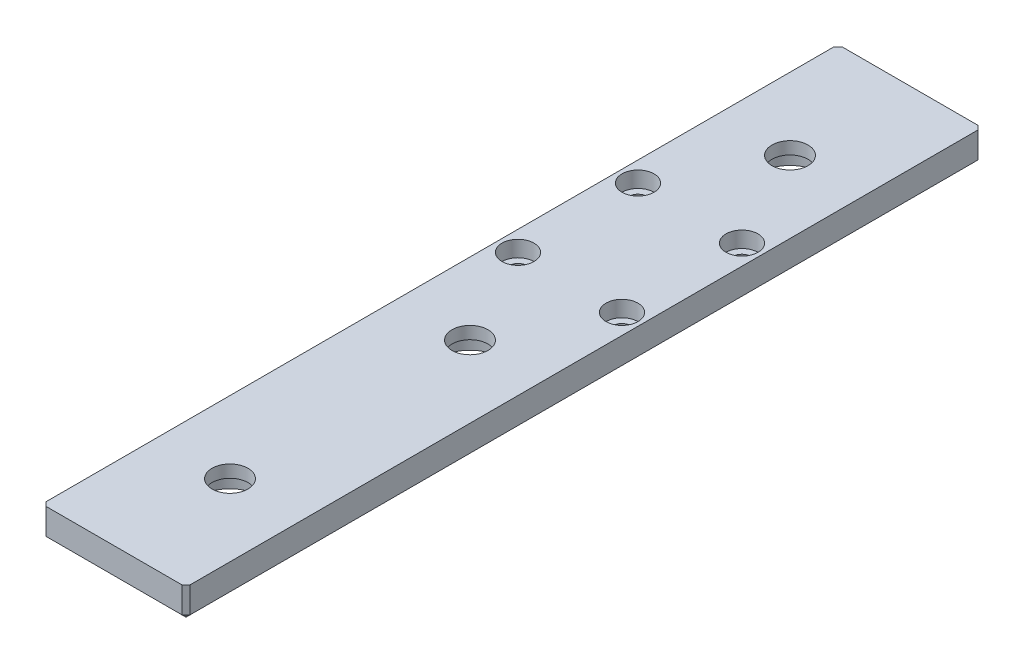
from build123d import *

# Parameters (mm, degrees)
SKETCH1_W                       = 36
SKETCH1_H                       = 199
BOSS_EXTRUDE1_DEPTH             = 7.5
CBORE_FOR_M4_SHCS1_D            = 4.5
CBORE_FOR_M4_SHCS1_CBORE_D      = 8
CBORE_FOR_M4_SHCS1_CBORE_DEPTH  = 4
CHAMFER1_SIZE                   = 1
CBORE_FOR_M8_SBHCS1_D           = 9
CBORE_FOR_M8_SBHCS1_CBORE_D     = 15
CBORE_FOR_M8_SBHCS1_CBORE_DEPTH = 4.4


with BuildPart() as part:
    # Sketch1 → Boss-Extrude1 (new body)
    with BuildSketch(Plane(origin=(0, 0, 0), x_dir=(1, 0, 0), z_dir=(0, 1, 0))):
        Rectangle(SKETCH1_W, SKETCH1_H)
    extrude(amount=BOSS_EXTRUDE1_DEPTH)

    # CBORE for M4 SHCS1 (through all)
    with Locations(Plane(origin=(0, 7.5, 0), x_dir=(1, 0, 0), z_dir=(0, 1, 0))):
        with Locations((-13, 44.5), (13, 44.5), (13, 14.5), (-13, 14.5)):
            CounterBoreHole(CBORE_FOR_M4_SHCS1_D / 2, CBORE_FOR_M4_SHCS1_CBORE_D / 2, CBORE_FOR_M4_SHCS1_CBORE_DEPTH)

    # Chamfer1
    chamfer1_edges = [part.edges().sort_by_distance(p)[0] for p in [
        (-18, 3.75, -99.5),
        (18, 3.75, -99.5),
        (-18, 3.75, 99.5),
        (18, 3.75, 99.5),
        (0, 0, -99.5),
        (-18, 0, 0),
        (0, 0, 99.5),
        (18, 0, 0),
    ]]
    chamfer(chamfer1_edges, length=CHAMFER1_SIZE)

    # CBORE for M8 SBHCS1 (through all)
    with Locations(Plane(origin=(0, 0, 0), x_dir=(-1, 0, 0), z_dir=(0, -1, 0))):
        with Locations((0, 69.5), (0, -10.5), (0, -70.5)):
            CounterBoreHole(CBORE_FOR_M8_SBHCS1_D / 2, CBORE_FOR_M8_SBHCS1_CBORE_D / 2, CBORE_FOR_M8_SBHCS1_CBORE_DEPTH)


solid = part.part
